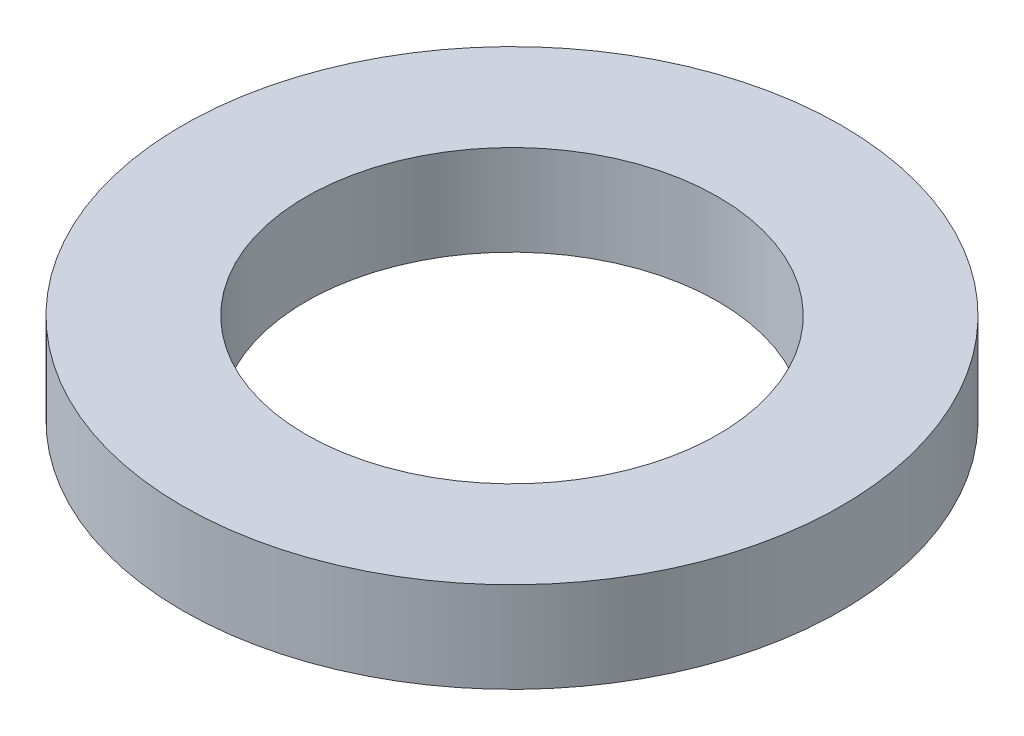
from build123d import *

# Parameters (mm, degrees)
SKETCH1_R           = 40
BOSS_EXTRUDE1_DEPTH = 11
SKETCH2_R           = 25
CUT_EXTRUDE1_DEPTH  = 58.628118137


with BuildPart() as part:
    # Sketch1 → Boss-Extrude1 (new body)
    with BuildSketch(Plane(origin=(0, 0, 0), x_dir=(1, 0, 0), z_dir=(0, 1, 0))):
        Circle(SKETCH1_R)
    extrude(amount=BOSS_EXTRUDE1_DEPTH)

    # Sketch2 → Cut-Extrude1 (cut, through all)
    with BuildSketch(Plane(origin=(0, 0, 0), x_dir=(1, 0, 0), z_dir=(0, 1, 0))):
        Circle(SKETCH2_R)
    extrude(amount=CUT_EXTRUDE1_DEPTH, mode=Mode.SUBTRACT)


solid = part.part
